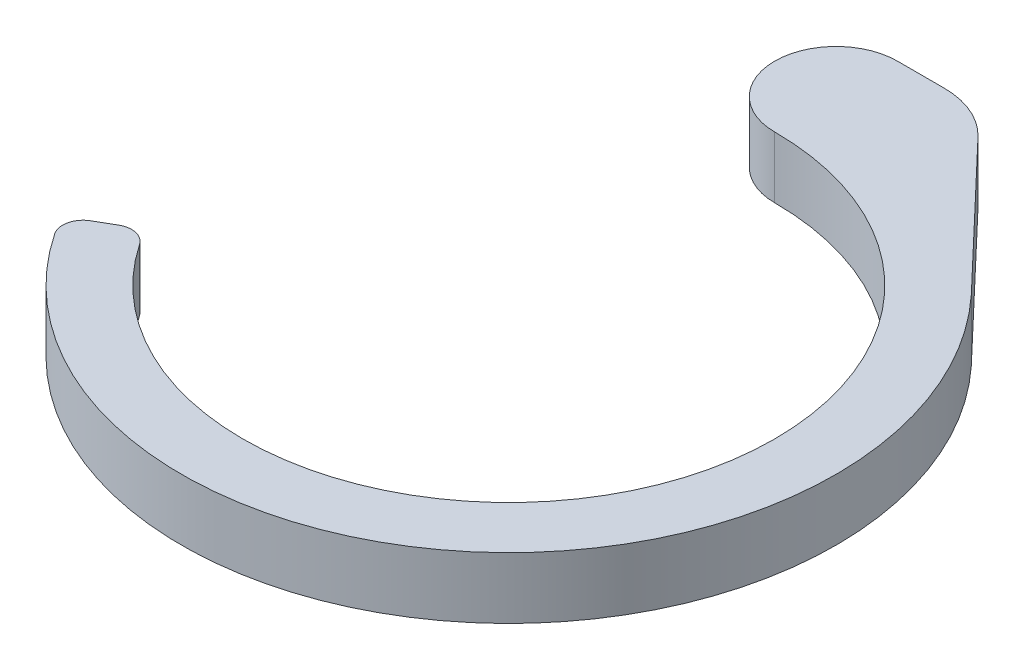
from build123d import *

# Parameters (mm, degrees)
EXTRUDE_4_DEPTH     = 15
SKETCH_3_R          = 10
CUT_EXTRUDE_1_DEPTH = 2


with BuildPart() as part:
    # ｽｹｯﾁ2 → ﾎﾞｽ - 押し出し4 (new body)
    with BuildSketch(Plane(origin=(0, 0, 0), x_dir=(1, 0, 0), z_dir=(0, 1, 0))):
        with BuildLine():
            ThreePointArc((-53.82643789, -36.437818048), (-56.846261527, -34.367935813), (-60.466933112, -34.910600109))
            Line((-60.466933112, -34.910600109), (-64.807406984, -37.416573868))
            ThreePointArc((-64.807406984, -37.416573868), (-67.177509772, -40.614402853), (-66.461234116, -44.529814279))
            ThreePointArc((-66.461234116, -44.529814279), (49.665387485, -62.716419588), (58.57572973, 54.487465409))
            Line((58.57572973, 54.487465409), (57.289371136, 55.838409315))
            Line((57.289371136, 55.838409315), (25.911523347, 88.791671712))
            ThreePointArc((25.911523347, 88.791671712), (19.306695871, 93.382511176), (11.427401304, 95))
            Line((11.427401304, 95), (0, 95))
            ThreePointArc((0, 95), (-15, 80), (0, 65))
            ThreePointArc((0, 65), (57.41714976, -30.467538684), (-53.82643789, -36.437818048))
        make_face()
    extrude(amount=EXTRUDE_4_DEPTH)

    # ｽｹｯﾁ3 → ｶｯﾄ - 押し出し1 (cut)
    with BuildSketch(Plane.XZ):
        with Locations((0, -80)):
            Circle(SKETCH_3_R)
    extrude(amount=-CUT_EXTRUDE_1_DEPTH, mode=Mode.SUBTRACT)


solid = part.part
